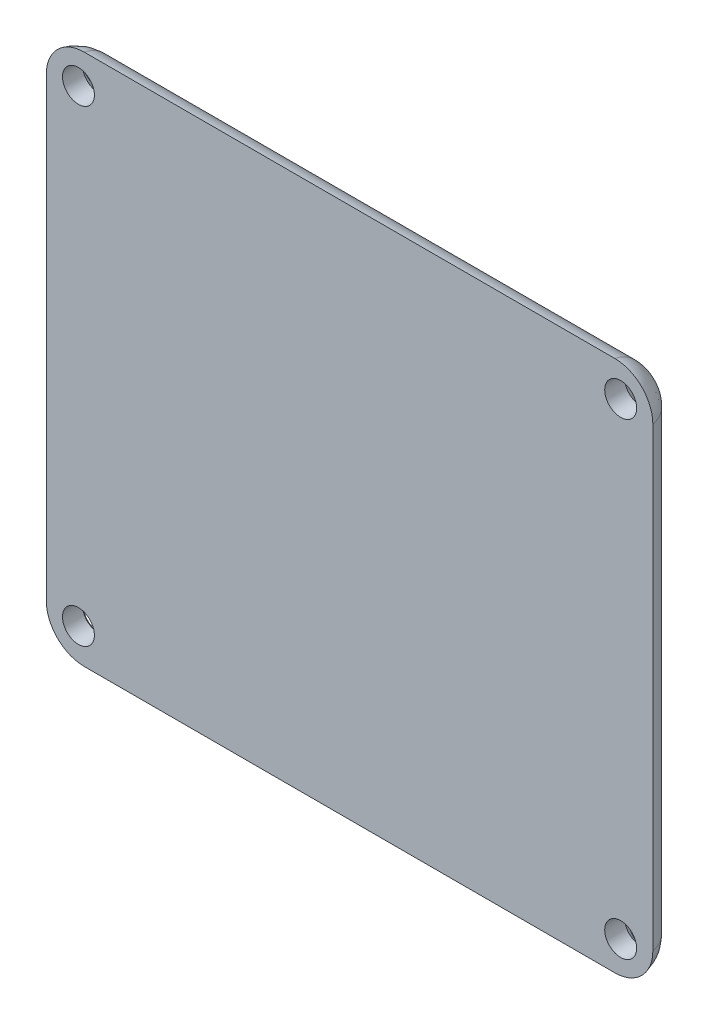
from build123d import *

# Parameters (mm, degrees)
IZIM1_W                     = 79.8
IZIM1_H                     = 70
Y_KSEKLIK_EKSTR_ZYON1_DEPTH = 4
RADYUS1_R                   = 5
RADYUS2_R                   = 5
DELIK1_D                    = 4.2
DELIK1_DEPTH                = 5
DELIK1_CSINK_D              = 6.5
DELIK1_CSINK_ANGLE          = 80


with BuildPart() as part:
    # Çizim1 → Yükseklik-Ekstrüzyon1 (new body)
    with BuildSketch(Plane.XY):
        Rectangle(IZIM1_W, IZIM1_H)
    extrude(amount=Y_KSEKLIK_EKSTR_ZYON1_DEPTH)

    # Radyus1
    radyus1_edges = [part.edges().sort_by_distance(p)[0] for p in [
        (39.9, -35, 2),
        (-39.9, -35, 2),
        (-39.9, 35, 2),
        (39.9, 35, 2),
    ]]
    fillet(radyus1_edges, radius=RADYUS1_R)

    # Radyus2
    # the kernel refuses this fillet: 5 mm, written as the material it takes off along each edge
    with BuildSketch(Plane(origin=(34.9, -30, 0), x_dir=(0, -1, 0), z_dir=(-1, 0, 0))) as radyus2_piece_1:
        with BuildLine():
            CenterArc((0.101020514, 5), RADYUS2_R, 270, 78.463040967)
            Line((5, 4), (5.09797959, 3.98))
            ThreePointArc((5.09797959, 3.98), (5.1, 2), (5.1, 0))
            Line((5.1, 0), (5, -0.1))
            Line((5, -0.1), (0.101020514, -0.1))
            Line((0.101020514, -0.1), (0.101020514, 0))
        make_face()
    revolve(axis=Axis((34.9, -30, 0), (0, 0, 1)), revolution_arc=90, mode=Mode.SUBTRACT)
    with BuildSketch(Plane(origin=(-34.9, -35, 0), x_dir=(0, 1.5720758028687172e-12, 1.0), z_dir=(1, 0, 0))) as radyus2_piece_2:
        with BuildLine():
            CenterArc((5, -4.898979486), RADYUS2_R, 101.536959033, 78.463040967)
            Line((0, -4.898979486), (-0.1, -4.898979486))
            Line((-0.1, -4.898979486), (-0.1, 0))
            Line((-0.1, 0), (0, 0.1))
            ThreePointArc((0, 0.1), (2, 0.1), (3.98, 0.09797959))
            Line((3.98, 0.09797959), (4, 0))
        make_face()
    extrude(amount=69.8, mode=Mode.SUBTRACT)
    with BuildSketch(Plane(origin=(-34.9, -30, 0), x_dir=(0, -1, 0), z_dir=(1, 0, 0))) as radyus2_piece_3:
        with BuildLine():
            CenterArc((0.101020514, -5), RADYUS2_R, 11.536959033, 78.463040967)
            Line((5, -4), (5.09797959, -3.98))
            ThreePointArc((5.09797959, -3.98), (5.1, -2), (5.1, 0))
            Line((5.1, 0), (5, 0.1))
            Line((5, 0.1), (0.101020514, 0.1))
            Line((0.101020514, 0.1), (0.101020514, 0))
        make_face()
    revolve(axis=Axis((-34.9, -30, 0), (0, 0, -1)), revolution_arc=90, mode=Mode.SUBTRACT)
    with BuildSketch(Plane(origin=(-39.9, 30, 0), x_dir=(1, 0, 0), z_dir=(0, -1, 0)), Plane(origin=(39.9, -30, 0), x_dir=(-1, 0, 0), z_dir=(0, 1, 0))) as radyus2_piece_4:
        with BuildLine():
            CenterArc((4.898979486, 5), RADYUS2_R, 191.536959033, 78.463040967)
            Line((0, 4), (-0.09797959, 3.98))
            ThreePointArc((-0.09797959, 3.98), (-0.1, 2), (-0.1, 0))
            Line((-0.1, 0), (0, -0.1))
            Line((0, -0.1), (4.898979486, -0.1))
            Line((4.898979486, -0.1), (4.898979486, 0))
        make_face()
    extrude(amount=60, mode=Mode.SUBTRACT)
    with BuildSketch(Plane(origin=(-34.9, 30, 0), x_dir=(0, 1, 0), z_dir=(1, 0, 0))) as radyus2_piece_5:
        with BuildLine():
            CenterArc((0.101020514, 5), RADYUS2_R, 270, 78.463040967)
            Line((5, 4), (5.09797959, 3.98))
            ThreePointArc((5.09797959, 3.98), (5.1, 2), (5.1, 0))
            Line((5.1, 0), (5, -0.1))
            Line((5, -0.1), (0.101020514, -0.1))
            Line((0.101020514, -0.1), (0.101020514, 0))
        make_face()
    revolve(axis=Axis((-34.9, 30, 0), (0, 0, 1)), revolution_arc=90, mode=Mode.SUBTRACT)
    with BuildSketch(Plane(origin=(34.9, 35, 0), x_dir=(0, -1, 0), z_dir=(-1, 0, 0))) as radyus2_piece_6:
        with BuildLine():
            CenterArc((4.898979486, 5), RADYUS2_R, 191.536959033, 78.463040967)
            Line((0, 4), (-0.09797959, 3.98))
            ThreePointArc((-0.09797959, 3.98), (-0.1, 2), (-0.1, 0))
            Line((-0.1, 0), (0, -0.1))
            Line((0, -0.1), (4.898979486, -0.1))
            Line((4.898979486, -0.1), (4.898979486, 0))
        make_face()
    extrude(amount=69.8, mode=Mode.SUBTRACT)
    with BuildSketch(Plane(origin=(34.9, 30, 0), x_dir=(1, 0, 0), z_dir=(0, -1, 0))) as radyus2_piece_7:
        with BuildLine():
            CenterArc((0.101020514, 5), RADYUS2_R, 270, 78.463040967)
            Line((5, 4), (5.09797959, 3.98))
            ThreePointArc((5.09797959, 3.98), (5.1, 2), (5.1, 0))
            Line((5.1, 0), (5, -0.1))
            Line((5, -0.1), (0.101020514, -0.1))
            Line((0.101020514, -0.1), (0.101020514, 0))
        make_face()
    revolve(axis=Axis((34.9, 30, 0), (0, 0, 1)), revolution_arc=90, mode=Mode.SUBTRACT)

    # Delik1
    with Locations(Plane(origin=(0, 0, 0), x_dir=(-1, 0, 0), z_dir=(0, 0, -1))):
        with Locations((-35.667766953, 30.767766953), (35.667766953, 30.767766953), (35.667766953, -30.767766953), (-35.667766953, -30.767766953)):
            CounterSinkHole(DELIK1_D / 2, DELIK1_CSINK_D / 2, depth=DELIK1_DEPTH, counter_sink_angle=DELIK1_CSINK_ANGLE)


solid = part.part
